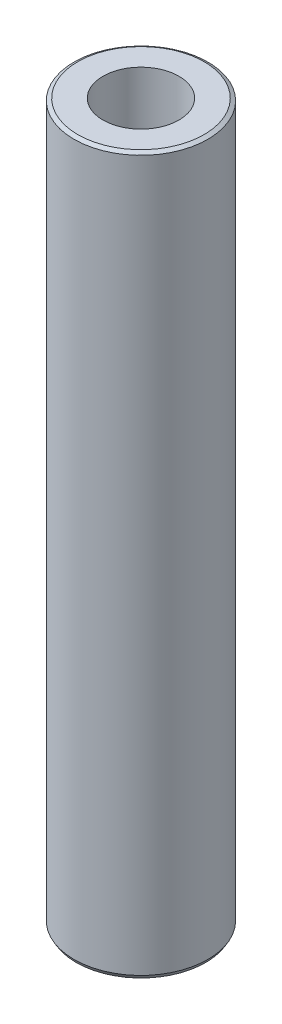
from build123d import *
from OCP.BRepFilletAPI import BRepFilletAPI_MakeChamfer

# Parameters (mm, degrees)
SKETCH1_R           = 35
BOSS_EXTRUDE1_DEPTH = 374.450062969
SKETCH2_R           = 19.857552491
CUT_EXTRUDE1_DEPTH  = 378.707359813
CHAMFER1_SIZE       = 1.139937405
CHAMFER1_SIZE2      = 1.974429503


with BuildPart() as part:
    # Sketch1 → Boss-Extrude1 (new body)
    with BuildSketch(Plane(origin=(0, 0, 0), x_dir=(1, 0, 0), z_dir=(0, 1, 0))):
        Circle(SKETCH1_R)
    extrude(amount=BOSS_EXTRUDE1_DEPTH)

    # Sketch2 → Cut-Extrude1 (cut, through all)
    with BuildSketch(Plane(origin=(0, 0, 0), x_dir=(1, 0, 0), z_dir=(0, 1, 0))):
        Circle(SKETCH2_R)
    extrude(amount=CUT_EXTRUDE1_DEPTH, mode=Mode.SUBTRACT)

    # Chamfer1: one chamfer whose edges measure the first distance from different faces: ONE call of the kernel's chamfer builder (chamfer() names one face for all edges)
    chamfer1_edges_1 = [part.edges().sort_by_distance(p)[0] for p in [
        (-35, 374.450062969, 0),
    ]]
    chamfer1_side_1 = [part.faces().sort_by_distance(p)[0] for p in [
        (-35, 187.225031484, 0),
    ]]
    chamfer1_edges_2 = [part.edges().sort_by_distance(p)[0] for p in [
        (-35, 0, 0),
    ]]
    chamfer1_side_2 = [part.faces().sort_by_distance(p)[0] for p in [
        (-34.010050506, 0, 0),
    ]]
    chamfer1 = BRepFilletAPI_MakeChamfer(part.part.solid().wrapped)
    for e in chamfer1_edges_1:
        chamfer1.Add(CHAMFER1_SIZE, CHAMFER1_SIZE2, e.wrapped, chamfer1_side_1[0].wrapped)  # the first distance lies on this face
    for e in chamfer1_edges_2:
        chamfer1.Add(CHAMFER1_SIZE, CHAMFER1_SIZE2, e.wrapped, chamfer1_side_2[0].wrapped)  # the first distance lies on this face
    add(Compound.cast(chamfer1.Shape()), mode=Mode.REPLACE)


solid = part.part
